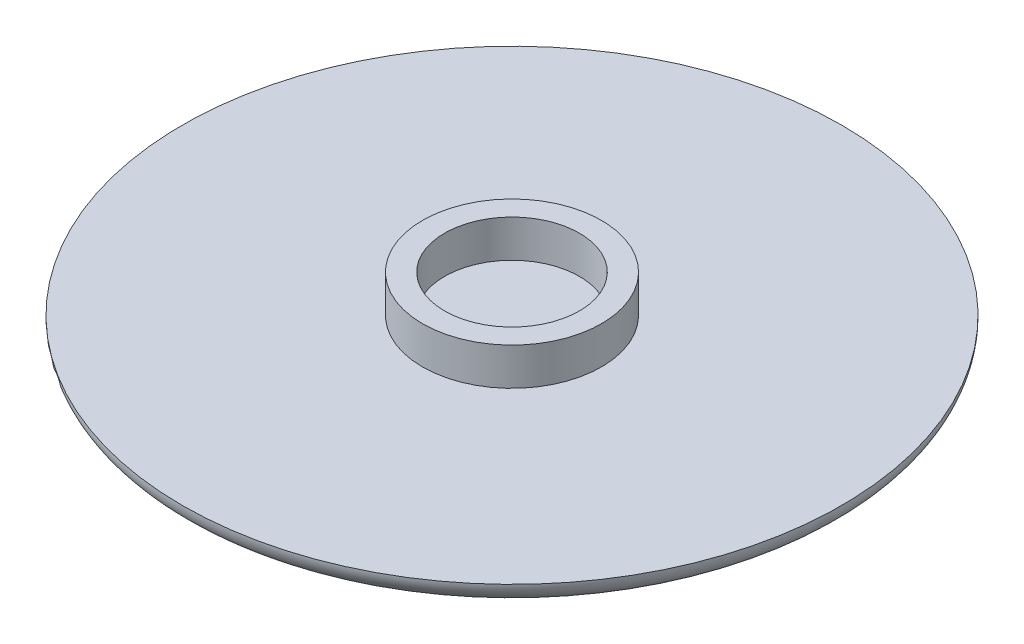
from build123d import *

# Parameters (mm, degrees)
SKETCH_1_R          = 11.95
SKETCH_1_R_2        = 9
EXTRUDE_1_DEPTH     = 5
SKETCH_2_R          = 44
EXTRUDE_2_DEPTH     = 3
FILLET_1_R          = 3
CUT_EXTRUDE_1_DEPTH = 0.4


with BuildPart() as part:
    # Эскиз1 → Бобышка-Вытянуть1 (new body)
    with BuildSketch(Plane(origin=(0, 0, 0), x_dir=(1, 0, 0), z_dir=(0, 1, 0))):
        with Locations(Location((0, 0, 0), (0, 0, 270))):
            Circle(SKETCH_1_R)
        with Locations(Location((0, 0, 0), (0, 0, 270))):
            Circle(SKETCH_1_R_2, mode=Mode.SUBTRACT)
    extrude(amount=EXTRUDE_1_DEPTH)

    # Эскиз2 → Бобышка-Вытянуть2 (add)
    with BuildSketch(Plane.XZ):
        with Locations(Location((0, 0, 0), (0, 0, 270))):
            Circle(SKETCH_2_R)
    extrude(amount=EXTRUDE_2_DEPTH)

    # Скругление1
    fillet_1_edges = [part.edges().sort_by_distance(p)[0] for p in [
        (0, -3, 44),
    ]]
    fillet(fillet_1_edges, radius=FILLET_1_R - 0.0001)  # a hair under: the kernel refuses the full size

    # Эскиз3 → Вырез-Вытянуть1 (cut)
    with BuildSketch(Plane.XZ.offset(3)):
        with BuildLine():
            Line((9.954559223, -5.855217729), (17.0939823, -6.624448498))
            add(Edge.make_bspline(
                [(17.0939823, -6.624448498), (16.954374573, -7.060364037), (16.67246957, -7.940593052), (16.082570182, -9.220685029), (15.367854468, -10.479237732), (14.549468275, -11.738227045), (13.598128393, -12.976714181), (12.508174471, -14.188327514), (11.307260102, -15.391109491), (9.994571436, -16.559013497), (8.599176625, -17.665541174), (7.097641414, -18.617186253), (5.53477836, -19.420340753), (3.908983058, -20.092788159), (2.213013482, -20.604345047), (0.449135236, -20.981542054), (-1.382110347, -21.198678471), (-2.625007466, -21.22599593), (-3.254575393, -21.239833113)],
                knots=[0, 0, 0, 0, 0.821440156, 1.658705401, 2.525323128, 3.419405186, 4.353419828, 5.32681938, 6.344399772, 7.404443113, 8.481060479, 9.538977106, 10.591299887, 11.633537695, 12.694215778, 13.768160887, 14.869500701, 16, 16, 16, 16], degree=3))
            add(Edge.make_bspline(
                [(-3.254575393, -21.239833113), (-4.037474252, -21.210468003), (-5.585963904, -21.152386976), (-7.859698842, -20.739484748), (-10.031214503, -20.033002378), (-12.082905697, -19.06267493), (-13.983263507, -17.838479622), (-15.628310659, -16.302835445), (-17.068788245, -14.551786811), (-18.226388665, -12.538555624), (-19.140015512, -10.335429034), (-19.780294703, -7.963227163), (-20.191471581, -5.448805692), (-20.238000287, -3.721455618), (-20.261786931, -2.838390806)],
                knots=[0, 0, 0, 0, 0.998551589, 1.975027533, 2.936744805, 3.903838964, 4.863557655, 5.807675034, 6.763178998, 7.745855275, 8.758641806, 9.797744155, 10.874151411, 12, 12, 12, 12], degree=3))
            add(Edge.make_bspline(
                [(-20.261786931, -2.838390806), (-20.253583862, -2.249072754), (-20.237148757, -1.068355571), (-20.071493014, 0.692734171), (-19.824593654, 2.443807008), (-19.457520681, 4.175543157), (-19.00443369, 5.89924412), (-18.436371871, 7.60283942), (-17.771918435, 9.296625216), (-17.009212067, 10.961487215), (-16.169576767, 12.570831605), (-15.246119859, 14.076076683), (-14.290825473, 15.491991281), (-13.257769645, 16.789715189), (-12.155533796, 17.973523587), (-11.00356969, 19.054320976), (-9.797035153, 20.040082521), (-8.518689542, 20.899962793), (-7.204489818, 21.664382583), (-5.862524589, 22.334760878), (-4.485868659, 22.886891815), (-3.083314583, 23.339978114), (-1.660006861, 23.708336607), (-0.208394214, 23.955377865), (1.268817222, 24.120842874), (2.265803014, 24.136773037), (2.767059223, 24.144782271)],
                knots=[0, 0, 0, 0, 1.075906032, 2.155611451, 3.227554832, 4.30373447, 5.38628686, 6.480642286, 7.581143633, 8.707391042, 9.82337293, 10.893692135, 11.930684225, 12.940768785, 13.919223559, 14.881988069, 15.823529777, 16.761054785, 17.692163021, 18.598508727, 19.497917784, 20.397951545, 21.288749041, 22.180057169, 23.084984307, 24, 24, 24, 24], degree=3))
            add(Edge.make_bspline(
                [(2.767059223, 24.144782271), (3.396819449, 24.13271298), (4.624674455, 24.109181262), (6.419415658, 23.873617188), (8.114533072, 23.493780483), (9.71479097, 22.957293415), (11.228369978, 22.293366902), (12.626669407, 21.438368521), (13.932702912, 20.448929523), (15.134462193, 19.318054618), (16.221199996, 18.057248477), (17.152473609, 16.665333162), (17.973572218, 15.181251724), (18.615932964, 13.571276078), (19.12246379, 11.857059969), (19.479861685, 10.030309351), (19.69885311, 8.096457894), (19.72490677, 6.769573083), (19.738213069, 6.091897656)],
                knots=[0, 0, 0, 0, 1.079196217, 2.10412856, 3.097265039, 4.052997914, 4.993829394, 5.924450447, 6.855882321, 7.798592485, 8.748507102, 9.702980304, 10.665060364, 11.651045023, 12.668191174, 13.725659051, 14.838433479, 16, 16, 16, 16], degree=3))
            add(Edge.make_bspline(
                [(19.738213069, 6.091897656), (19.711530906, 5.012347464), (19.657182115, 2.813415932), (19.336536232, 0.637210246), (19.173309223, -0.470602344)],
                knots=[0, 0, 0, 0, 0.981886135, 2, 2, 2, 2], degree=3))
            Line((19.173309223, -0.470602344), (-12.569479239, -0.470602344))
            add(Edge.make_bspline(
                [(-12.569479239, -0.470602344), (-12.686010265, -0.684825825), (-12.905708031, -1.088704703), (-13.155238164, -1.702843602), (-13.305966259, -2.286193686), (-13.328203982, -2.669377879), (-13.338710008, -2.850410037)],
                knots=[0, 0, 0, 0, 1.156942796, 2.181202349, 3.140724307, 4, 4, 4, 4], degree=3))
            add(Edge.make_bspline(
                [(-13.338710008, -2.850410037), (-13.329201362, -3.363533664), (-13.310745354, -4.359491854), (-13.176596758, -5.804983514), (-12.964076928, -7.159922166), (-12.658814238, -8.421765438), (-12.240072534, -9.58253052), (-11.763714111, -10.662876848), (-11.191471954, -11.653246376), (-10.509245809, -12.527103519), (-9.781157621, -13.313071224), (-8.993901514, -13.981427574), (-8.186858669, -14.571826363), (-7.326503521, -15.044385035), (-6.422970918, -15.399496847), (-5.487224957, -15.67198157), (-4.510031445, -15.830569123), (-3.844080664, -15.846933933), (-3.506979239, -15.855217729)],
                knots=[0, 0, 0, 0, 1.346284225, 2.613098929, 3.805631801, 4.942804233, 6.013450698, 7.039235158, 8.038108926, 9.00533571, 9.942442562, 10.84439418, 11.710848438, 12.56244313, 13.41163356, 14.253504373, 15.115931414, 16, 16, 16, 16], degree=3))
            add(Edge.make_bspline(
                [(-3.506979239, -15.855217729), (-2.858509214, -15.827358464), (-1.550821401, -15.771178193), (0.380315515, -15.234581986), (2.305705802, -14.442665665), (3.842751413, -13.498748209), (5.053499235, -12.625146746), (5.900225032, -11.858088786), (6.717542295, -11.040465602), (7.465873942, -10.135485129), (8.183042091, -9.175321866), (8.828146274, -8.133230752), (9.436128603, -7.030114624), (9.780061437, -6.250674515), (9.954559223, -5.855217729)],
                knots=[0, 0, 0, 0, 1.313044299, 2.647851039, 4.03980324, 5.527339259, 6.29475363, 7.066375866, 7.842396062, 8.63863277, 9.446691243, 10.272184996, 11.123375662, 12, 12, 12, 12], degree=3))
        make_face()
        with BuildLine():
            Line((-11.391594623, 4.91401304), (12.779078454, 4.91401304))
            add(Edge.make_bspline(
                [(12.779078454, 4.91401304), (12.787709895, 5.258551796), (12.802161832, 5.835425615), (12.811411041, 6.41240478), (12.815136146, 6.644782271)],
                knots=[0, 0, 0, 0, 1.194503009, 2, 2, 2, 2], degree=3))
            add(Edge.make_bspline(
                [(12.815136146, 6.644782271), (12.803898897, 7.117699119), (12.781959502, 8.041013127), (12.670145666, 9.384414471), (12.449186915, 10.640968329), (12.156588483, 11.815328923), (11.751690213, 12.896198212), (11.293094857, 13.905101329), (10.71543559, 14.812813231), (10.071782115, 15.638694593), (9.359494816, 16.377148538), (8.592848863, 17.01350722), (7.772383486, 17.549245443), (6.910455487, 17.999648964), (5.985412837, 18.329941166), (5.022728372, 18.590023931), (4.005305708, 18.732775986), (3.312338023, 18.750923328), (2.959366915, 18.760166887)],
                knots=[0, 0, 0, 0, 1.288915635, 2.516454775, 3.668675548, 4.762204166, 5.808675246, 6.809806692, 7.776046417, 8.732555008, 9.659000055, 10.566141369, 11.441184925, 12.324901883, 13.209090714, 14.112018255, 15.038334656, 16, 16, 16, 16], degree=3))
            add(Edge.make_bspline(
                [(2.959366915, 18.760166887), (2.569950261, 18.753640128), (1.799322271, 18.740724135), (0.659341059, 18.554273421), (-0.460843427, 18.303647562), (-1.545658439, 17.905847871), (-2.609502644, 17.425759439), (-3.649545731, 16.838318089), (-4.643906234, 16.113950662), (-5.632504092, 15.317947338), (-6.575317711, 14.401029882), (-7.44471318, 13.362562561), (-8.275005659, 12.230615841), (-9.006135858, 10.970703852), (-9.718002889, 9.624439846), (-10.328585973, 8.148804352), (-10.917153248, 6.578634088), (-11.231013188, 5.477427724), (-11.391594623, 4.91401304)],
                knots=[0, 0, 0, 0, 0.867869597, 1.717452491, 2.571772394, 3.425671253, 4.289803496, 5.174634535, 6.084973587, 7.031591473, 8.005136717, 9.013559597, 10.050697067, 11.133079613, 12.260592687, 13.446148552, 14.693362615, 16, 16, 16, 16], degree=3))
        make_face(mode=Mode.SUBTRACT)
    extrude(amount=-CUT_EXTRUDE_1_DEPTH, mode=Mode.SUBTRACT)


solid = part.part
